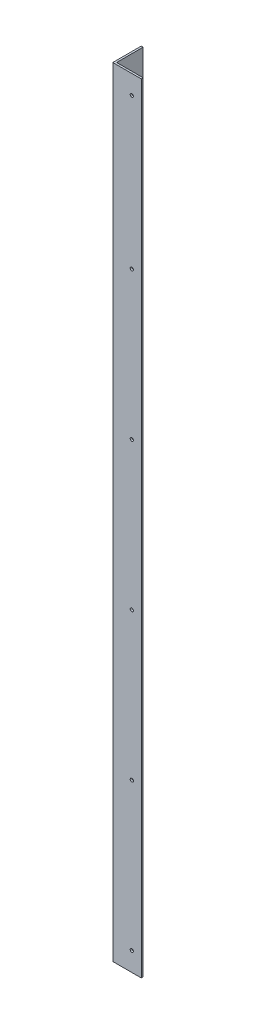
from build123d import *

# Parameters (mm, degrees)
ESTRUSIONE_ESTRUSIONE1_DEPTH = 819
SCHIZZO3_R                   = 1.7
TAGLIO_ESTRUSIONE1_DEPTH     = 821.098164856


with BuildPart() as part:
    # Schizzo2 → Estrusione-Estrusione1 (new body)
    with BuildSketch(Plane(origin=(0, 0, 0), x_dir=(1, 0, 0), z_dir=(0, 1, 0))):
        Polygon((0, 0), (30, 0), (30, 2), (2, 2), (2, 30), (0, 30), align=None)
    extrude(amount=ESTRUSIONE_ESTRUSIONE1_DEPTH)

    # Schizzo3 → Taglio-Estrusione1 (cut, through all)
    with BuildSketch(Plane.XY):
        with Locations((20, 20)):
            Circle(SCHIZZO3_R)
        with Locations((20, 330.4)):
            Circle(SCHIZZO3_R)
        with Locations((20, 485.6)):
            Circle(SCHIZZO3_R)
        with Locations((20, 175.2)):
            Circle(SCHIZZO3_R)
        with Locations((20, 640.8)):
            Circle(SCHIZZO3_R)
        with Locations((20, 799)):
            Circle(SCHIZZO3_R)
    extrude(amount=-TAGLIO_ESTRUSIONE1_DEPTH, mode=Mode.SUBTRACT)


solid = part.part
